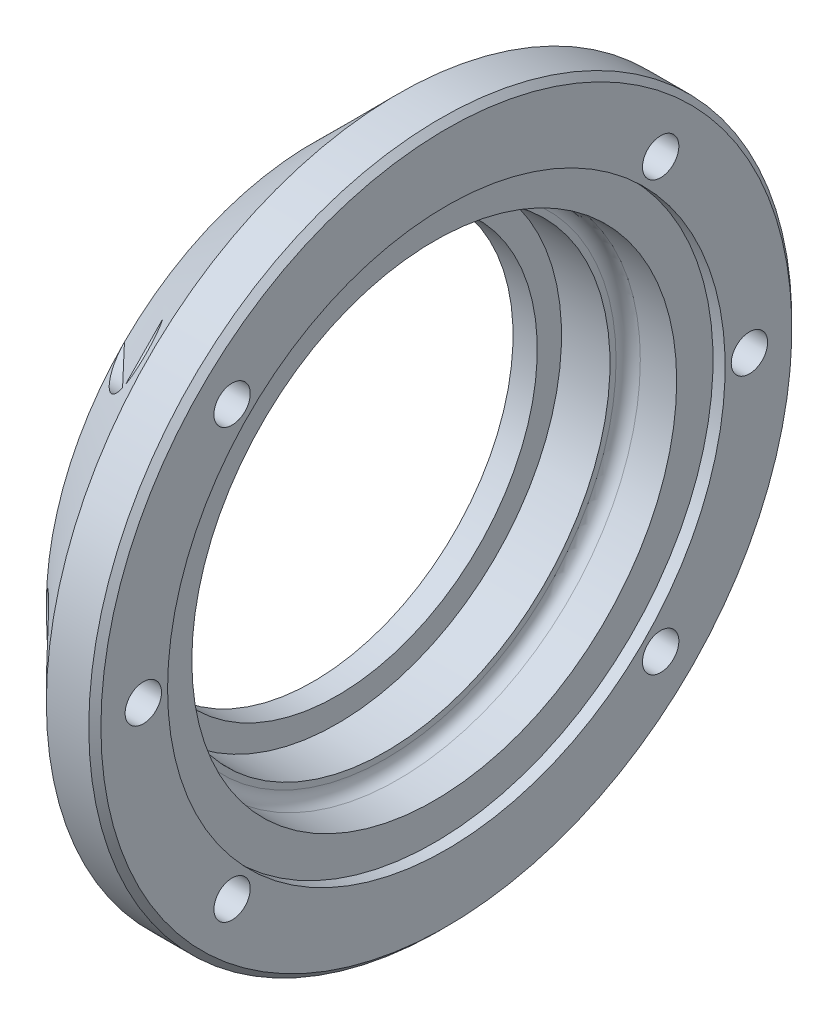
from build123d import *

# Parameters (mm, degrees)
SZKIC3_R                   = 3
WYTNIJ_WYCI_GNI_CIE1_DEPTH = 7
SZKIC4_R                   = 1.5
WYTNIJ_WYCI_GNI_CIE2_DEPTH = 43.461747628


with BuildPart() as part:
    # Szkic2 → Obrót1 (revolve)
    with BuildSketch(Plane(origin=(0, 0, 0), x_dir=(1, 0, 0), z_dir=(0, 1, 0))):
        with BuildLine():
            Line((7, 20), (10, 20))
            Line((10, 20), (10, 23))
            Line((10, 23), (11, 23))
            Line((11, 23), (11, 28.5))
            Line((11, 28.5), (10.5, 29))
            Line((10.5, 29), (7, 29))
            Line((7, 29), (0, 22))
            Line((0, 22), (0, 16.5))
            Line((0, 16.5), (2, 16.5))
            Line((2, 16.5), (2, 18.5))
            Line((2, 18.5), (6, 18.5))
            Line((6, 18.5), (6, 19))
            ThreePointArc((6, 19), (6.292893219, 19.707106781), (7, 20))
        make_face()
    revolve(axis=Axis((0, 0, 0), (1, 0, 0)))

    # Szkic3 → Wytnij-wyciągnięcie1 (cut)
    with BuildSketch(Plane.ZY):
        with Locations((17.67766953, 17.67766953)):
            Circle(SZKIC3_R)
        with Locations((25, 0)):
            Circle(SZKIC3_R)
        with Locations((17.67766953, -17.67766953)):
            Circle(SZKIC3_R)
        with Locations((-17.67766953, -17.67766953)):
            Circle(SZKIC3_R)
        with Locations((-25, 0)):
            Circle(SZKIC3_R)
        with Locations((-17.67766953, 17.67766953)):
            Circle(SZKIC3_R)
    extrude(amount=-WYTNIJ_WYCI_GNI_CIE1_DEPTH, mode=Mode.SUBTRACT)

    # Szkic4 → Wytnij-wyciągnięcie2 (cut, through all)
    with BuildSketch(Plane.ZY):
        with Locations((17.67766953, 17.67766953)):
            Circle(SZKIC4_R)
        with Locations((25, 0)):
            Circle(SZKIC4_R)
        with Locations((17.67766953, -17.67766953)):
            Circle(SZKIC4_R)
        with Locations((-17.67766953, -17.67766953)):
            Circle(SZKIC4_R)
        with Locations((-25, 0)):
            Circle(SZKIC4_R)
        with Locations((-17.67766953, 17.67766953)):
            Circle(SZKIC4_R)
    extrude(amount=-WYTNIJ_WYCI_GNI_CIE2_DEPTH, mode=Mode.SUBTRACT)


solid = part.part
